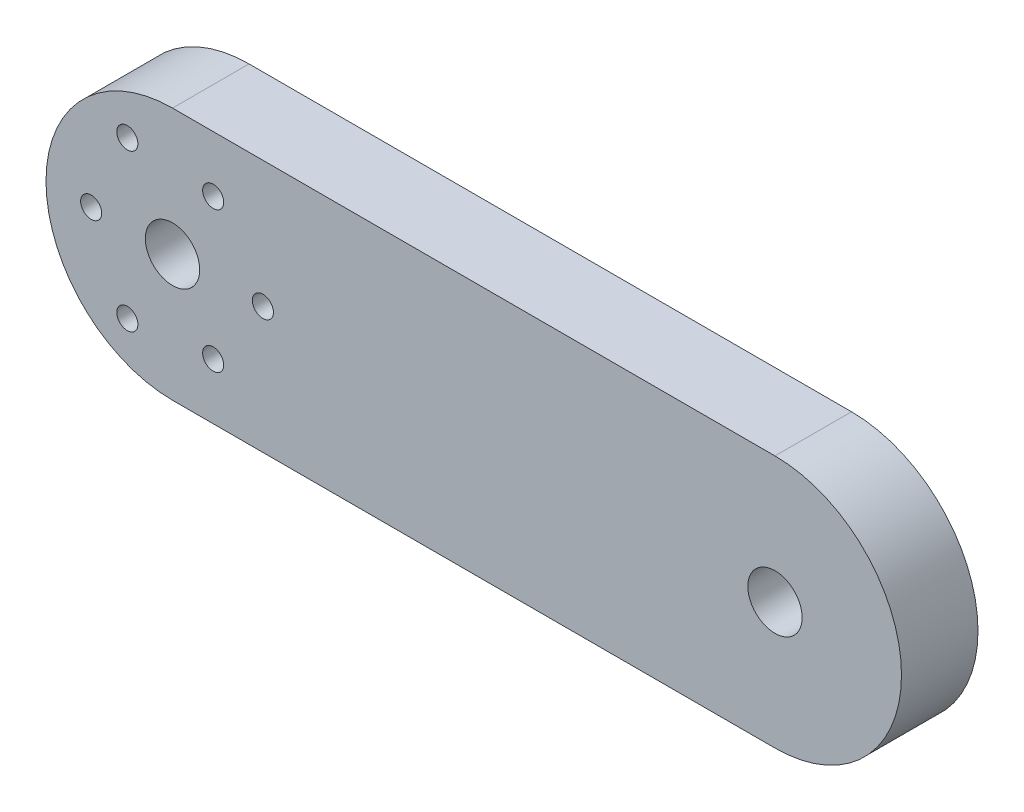
from build123d import *

# Parameters (mm, degrees)
SKETCH1_R           = 4.5085
SKETCH1_R_2         = 1.75
BOSS_EXTRUDE2_DEPTH = 12.7


with BuildPart() as part:
    # Sketch1 → Boss-Extrude2 (new body)
    with BuildSketch(Plane.XY):
        with BuildLine():
            Line((0, 21), (100, 21))
            ThreePointArc((100, 21), (121, 0), (100, -21))
            Line((100, -21), (0, -21))
            ThreePointArc((0, -21), (-21, 0), (0, 21))
        make_face()
        with Locations((100, 0)):
            Circle(SKETCH1_R, mode=Mode.SUBTRACT)
        with Locations((15, 0)):
            Circle(SKETCH1_R_2, mode=Mode.SUBTRACT)
        with Locations((-7.5, -12.990381057)):
            Circle(SKETCH1_R_2, mode=Mode.SUBTRACT)
        with Locations((-7.5, 12.990381057)):
            Circle(SKETCH1_R_2, mode=Mode.SUBTRACT)
        Circle(SKETCH1_R, mode=Mode.SUBTRACT)
        with Locations((-13.5, 0)):
            Circle(SKETCH1_R_2, mode=Mode.SUBTRACT)
        with Locations((6.75, 11.691342951)):
            Circle(SKETCH1_R_2, mode=Mode.SUBTRACT)
        with Locations((6.75, -11.691342951)):
            Circle(SKETCH1_R_2, mode=Mode.SUBTRACT)
    extrude(amount=BOSS_EXTRUDE2_DEPTH)


solid = part.part
